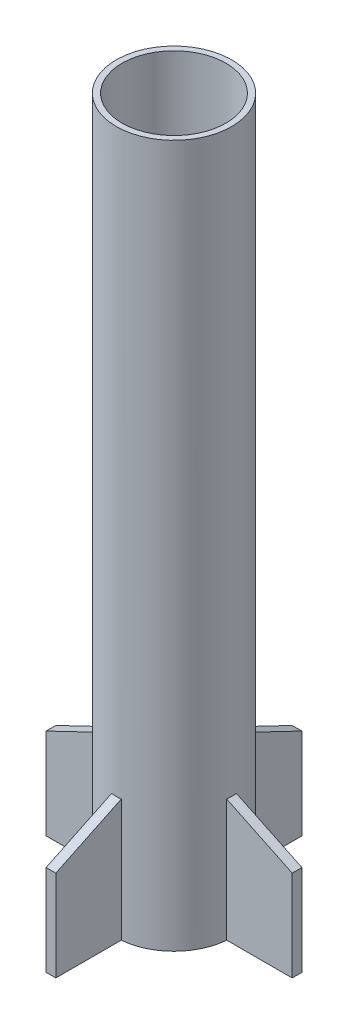
from build123d import *

# Parameters (mm, degrees)
SKETCH1_R                = 11.925
SKETCH1_R_2              = 9.525
BOSS_EXTRUDE1_DEPTH      = 145
BOSS_EXTRUDE2_DEPTH      = 1
CIRPATTERN1_COUNT        = 4
SKETCH3_R                = 7.325
SKETCH3_R_2              = 6.125
BOSS_EXTRUDE3_DEPTH      = 87.75
CUT_EXTRUDE1_START       = -19
SKETCH4_R                = 10.725
SKETCH4_R_2              = 9.525
CUT_EXTRUDE1_DEPTH       = 19
BOSS_EXTRUDE4_START      = -1
SKETCH5_R                = 9.525
SKETCH5_R_2              = 6.125
BOSS_EXTRUDE4_DEPTH      = 1
BOSS_EXTRUDE5_DEPTH      = 0.5
BOSS_EXTRUDE5_DEPTH_BACK = 0.5
SKETCH6_R                = 9.525
SKETCH6_R_2              = 6.125
SKETCH7_R                = 9.525
SKETCH7_R_2              = 6.125
BOSS_EXTRUDE6_DEPTH      = 1


with BuildPart() as part:
    # Sketch1 → Boss-Extrude1 (new body)
    with BuildSketch(Plane(origin=(0, 0, 0), x_dir=(1, 0, 0), z_dir=(0, 1, 0))):
        Circle(SKETCH1_R)
        Circle(SKETCH1_R_2, mode=Mode.SUBTRACT)
    extrude(amount=BOSS_EXTRUDE1_DEPTH)

    # Sketch2 → Boss-Extrude2 (add, symmetric)
    with BuildSketch(Plane.XY):
        Polygon((-9.525, 0), (-9.525, 0.375), (-6.397493745, 0.375), (-6.397493745, 25.875), (-9.525, 25.875), (-9.525, 26.25), (-9.780127693, 26.25), (-25.405127693, 18.75), (-25.405127693, 0), align=None)
    boss_extrude2 = extrude(amount=BOSS_EXTRUDE2_DEPTH, both=True)

    # CirPattern1: Boss-Extrude2 ×4 about axis
    cirpattern1_axis = Axis((0, 145, 0), (0, -1, 0))
    for i in range(1, CIRPATTERN1_COUNT):
        add(boss_extrude2.rotate(cirpattern1_axis, i * 360 / CIRPATTERN1_COUNT))

    # Sketch4 → Cut-Extrude1 (cut)
    with BuildSketch(Plane(origin=(0, 145, 0), x_dir=(1, 0, 0), z_dir=(0, 1, 0)).offset(CUT_EXTRUDE1_START)):
        Circle(SKETCH4_R)
        Circle(SKETCH4_R_2, mode=Mode.SUBTRACT)
    extrude(amount=CUT_EXTRUDE1_DEPTH, mode=Mode.SUBTRACT)



with BuildPart() as body_2:
    # Sketch3 → Boss-Extrude3 (new body)
    with BuildSketch(Plane.XZ):
        Circle(SKETCH3_R)
        Circle(SKETCH3_R_2, mode=Mode.SUBTRACT)
    extrude(amount=-BOSS_EXTRUDE3_DEPTH)


with BuildPart() as part_1:
    add(part.part)

    add(body_2.part)  # Boss-Extrude4 merges body 2
    # Sketch5 → Boss-Extrude4 (add)
    with BuildSketch(Plane(origin=(0, 87.75, 0), x_dir=(1, 0, 0), z_dir=(0, 1, 0)).offset(BOSS_EXTRUDE4_START)):
        Circle(SKETCH5_R)
        Circle(SKETCH5_R_2, mode=Mode.SUBTRACT)
    extrude(amount=BOSS_EXTRUDE4_DEPTH)

    # Sketch6 → Boss-Extrude5 (add, two sides: drawn at the far end of the back side and taken through both)
    with BuildSketch(Plane(origin=(0, 43.875, 0), x_dir=(1, 0, 0), z_dir=(0, 1, 0)).offset(-BOSS_EXTRUDE5_DEPTH_BACK)):
        Circle(SKETCH6_R)
        Circle(SKETCH6_R_2, mode=Mode.SUBTRACT)
    extrude(amount=BOSS_EXTRUDE5_DEPTH + BOSS_EXTRUDE5_DEPTH_BACK)

    # Sketch7 → Boss-Extrude6 (add)
    with BuildSketch(Plane.XZ):
        Circle(SKETCH7_R)
        Circle(SKETCH7_R_2, mode=Mode.SUBTRACT)
    extrude(amount=-BOSS_EXTRUDE6_DEPTH)


solid = part_1.part
